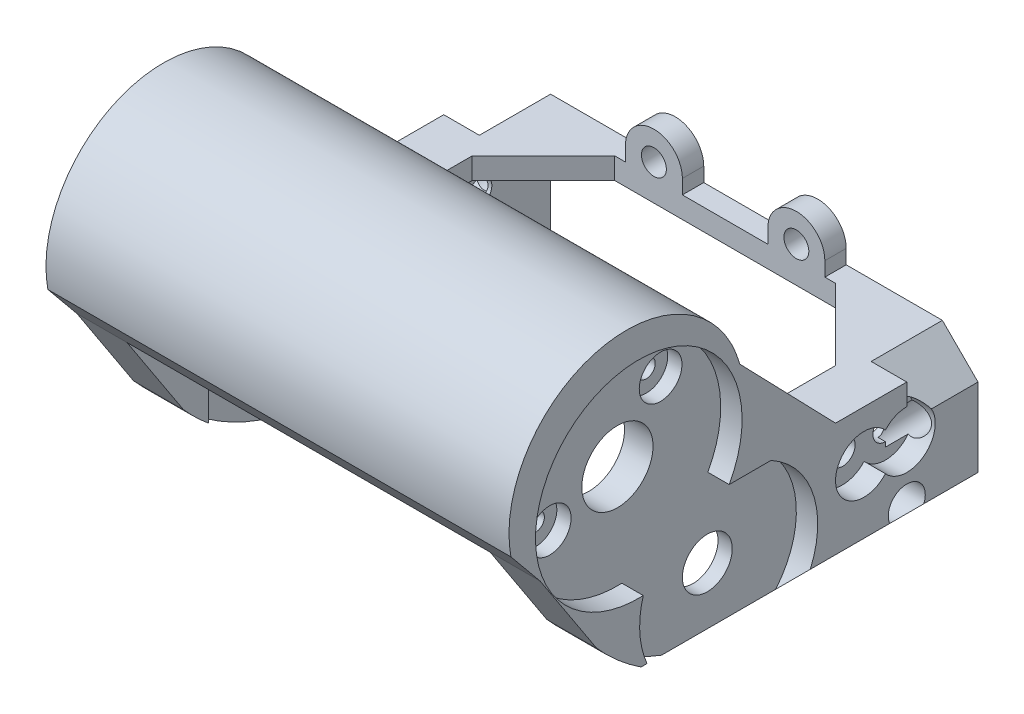
from build123d import *

# Parameters (mm, degrees)
BOSS_EXTRUDE1_DEPTH             = 50
CHAMFER1_SIZE                   = 7
SKETCH2_R                       = 3.5
CUT_EXTRUDE1_DEPTH              = 62.524385409
SKETCH3_R                       = 1.75
CUT_EXTRUDE2_DEPTH              = 62.524385409
SKETCH5_R                       = 12.5
CUT_EXTRUDE4_DEPTH              = 3
BOSS_EXTRUDE2_DEPTH             = 7
CUT_EXTRUDE3_DEPTH              = 77.547867994
CUT_EXTRUDE3_DEPTH_BACK         = 77.547867994
SKETCH4_W                       = 51
SKETCH4_H                       = 47
SKETCH7_R                       = 1.25
SKETCH7_R_2                     = 5
CUT_EXTRUDE5_DEPTH              = 103.505990745
SKETCH8_R                       = 14.5
CUT_EXTRUDE6_DEPTH              = 3
SKETCH9_R                       = 3
CUT_EXTRUDE7_DEPTH              = 2
SKETCH11_R                      = 2
CUT_EXTRUDE8_DEPTH              = 10
BOSS_EXTRUDE3_START             = -32.5
BOSS_EXTRUDE3_DEPTH             = 65
SKETCH12_R                      = 2.6
CUT_EXTRUDE9_DEPTH              = 105.684053225
CUT_EXTRUDE10_DEPTH             = 3
BOSS_EXTRUDE4_DEPTH             = 3
SKETCH16_R                      = 1.75
CUT_EXTRUDE12_DEPTH             = 8
CHAMFER2_SIZE                   = 10
CUT_EXTRUDE14_DEPTH             = 10
CUT_EXTRUDE15_DEPTH             = 89.260982281
CUT_EXTRUDE15_DEPTH_BACK        = 89.260982281
CUT_EXTRUDE16_REACH             = 90.261
SKETCH19_R                      = 11
CUT_EXTRUDE16_DIRECTION_2_REACH = 90.261


# Read off the part's stored shape, not the designer's step: Mirror1
with BuildPart() as part:
    # Sketch1 → Boss-Extrude1 (new body)
    with BuildSketch(Plane.XY):
        Polygon((-27.5, 0), (-27.5, 20), (0, 20), (0, 23), (-32.5, 23), (-32.5, 0), align=None)
    extrude(amount=BOSS_EXTRUDE1_DEPTH)

    # Chamfer1
    # the kernel refuses this chamfer: 7 mm, written as the material it takes off along each edge
    with BuildSketch(Plane(origin=(-32.5, 0, -18.001780916), x_dir=(-0.02749587661058612, 0.9996219169112968, 0), z_dir=(0, 0, 1))) as chamfer1_piece_1:
        Polygon((CHAMFER1_SIZE * 0.999621916911, -CHAMFER1_SIZE * 0.0274958766106), (-CHAMFER1_SIZE * 0.0274958766106, -CHAMFER1_SIZE * 0.999621916911), (0, 0), align=None)
    extrude(amount=86.003561832, mode=Mode.SUBTRACT)

    # Sketch2 → Cut-Extrude1 (cut, through all)
    with BuildSketch(Plane(origin=(-27.5, 0, 0), x_dir=(0, 0, -1), z_dir=(1, 0, 0))):
        with Locations((-35, 12)):
            Circle(SKETCH2_R)
    extrude(amount=-CUT_EXTRUDE1_DEPTH, mode=Mode.SUBTRACT)

    # Sketch3 → Cut-Extrude2 (cut, through all)
    with BuildSketch(Plane(origin=(-27.5, 0, 0), x_dir=(0, 0, -1), z_dir=(1, 0, 0))):
        with Locations((-10, 16)):
            Circle(SKETCH3_R)
        with Locations((-16, 16)):
            Circle(SKETCH3_R)
    extrude(amount=-CUT_EXTRUDE2_DEPTH, mode=Mode.SUBTRACT)

    # Sketch5 → Cut-Extrude4 (cut)
    with BuildSketch(Plane.ZY.offset(32.5)):
        with Locations((35, 12)):
            Circle(SKETCH5_R)
    extrude(amount=-CUT_EXTRUDE4_DEPTH, mode=Mode.SUBTRACT)

    # Sketch6 → Boss-Extrude2 (add)
    with BuildSketch(Plane.ZY.offset(32.5)):
        with BuildLine():
            Line((38.91656851, 42.559195759), (20, 23))
            Line((20, 23), (41.190648452, 23))
            ThreePointArc((41.190648452, 23), (45.305332833, 20.647646722), (50, 19.996268429))
            Line((50, 19.996268429), (50, 7))
            Line((50, 7), (61.474012963, 24.541456905))
            ThreePointArc((61.474012963, 24.541456905), (58.38884507, 43.808308659), (38.91656851, 42.559195759))
        make_face()
    extrude(amount=-BOSS_EXTRUDE2_DEPTH)

    # Mirror1: part across plane


with BuildPart() as part_1:
    add(part.part)
    add(part.part.mirror(Plane(origin=(0, 0, 0), x_dir=(0, 0, 1), z_dir=(1, 0, 0))))

    # Sketch4 → Cut-Extrude3 (cut, two sides: drawn at the far end of the back side and taken through both)
    with BuildSketch(Plane.XZ.offset(-20).offset(-CUT_EXTRUDE3_DEPTH_BACK)):
        with Locations((0, 26.5)):
            Rectangle(SKETCH4_W, SKETCH4_H)
    extrude(amount=CUT_EXTRUDE3_DEPTH + CUT_EXTRUDE3_DEPTH_BACK, mode=Mode.SUBTRACT)

    # Sketch7 → Cut-Extrude5 (cut, through all)
    with BuildSketch(Plane.ZY.offset(32.5)):
        with Locations(Location((41.557466488, 37.927777253, 0), (0, 0, 270))):
            Circle(SKETCH7_R)
        with Locations(Location((57.12135533, 27.029824962, 0), (0, 0, 270))):
            Circle(SKETCH7_R)
        with Locations(Location((47.6186816, 30.021344974, 0), (0, 0, 270))):
            Circle(SKETCH7_R_2)
    extrude(amount=-CUT_EXTRUDE5_DEPTH, mode=Mode.SUBTRACT)

    # Sketch8 → Cut-Extrude6 (cut)
    with BuildSketch(Plane.ZY.offset(32.5)):
        with Locations((47.6186816, 30.021344974)):
            Circle(SKETCH8_R)
    cut_extrude6 = extrude(amount=-CUT_EXTRUDE6_DEPTH, mode=Mode.SUBTRACT)

    # Sketch9 → Cut-Extrude7 (cut)
    with BuildSketch(Plane.ZY.offset(29.5)):
        with Locations(Location((41.557466488, 37.927777253, 0), (0, 0, 270))):
            Circle(SKETCH9_R)
        with Locations(Location((57.12135533, 27.029824962, 0), (0, 0, 270))):
            Circle(SKETCH9_R)
    cut_extrude7 = extrude(amount=-CUT_EXTRUDE7_DEPTH, mode=Mode.SUBTRACT)

    # Sketch11 → Cut-Extrude8 (cut)
    with BuildSketch(Plane(origin=(0, 0, 0), x_dir=(-1, 0, 0), z_dir=(0, 0, -1))):
        with Locations((-30, 15.523029521)):
            Circle(SKETCH11_R)
    cut_extrude8 = extrude(amount=-CUT_EXTRUDE8_DEPTH, mode=Mode.SUBTRACT)

    # Mirror2: Cut-Extrude6, Cut-Extrude7, Cut-Extrude8 across plane
    add(cut_extrude6.mirror(Plane(origin=(0, 0, 0), x_dir=(0, 0, 1), z_dir=(1, 0, 0))), mode=Mode.SUBTRACT)
    add(cut_extrude7.mirror(Plane(origin=(0, 0, 0), x_dir=(0, 0, 1), z_dir=(1, 0, 0))), mode=Mode.SUBTRACT)
    add(cut_extrude8.mirror(Plane(origin=(0, 0, 0), x_dir=(0, 0, 1), z_dir=(1, 0, 0))), mode=Mode.SUBTRACT)

    # Sketch10 → Boss-Extrude3 (add)
    with BuildSketch(Plane(origin=(0, 0, 0), x_dir=(0, 0, -1), z_dir=(1, 0, 0)).offset(BOSS_EXTRUDE3_START)):
        with BuildLine():
            Line((-38.91656851, 42.559195759), (-33.44256114, 36.899227268))
            ThreePointArc((-33.44256114, 36.899227268), (-53.026270805, 48.561620018), (-65.574367209, 29.533263138))
            Line((-65.574367209, 29.533263138), (-61.474012963, 24.541456905))
            ThreePointArc((-61.474012963, 24.541456905), (-58.38884507, 43.808308659), (-38.91656851, 42.559195759))
        make_face()
    extrude(amount=BOSS_EXTRUDE3_DEPTH)

    # Sketch12 → Cut-Extrude9 (cut, through all)
    with BuildSketch(Plane(origin=(32.5, 0, 0), x_dir=(0, 0, -1), z_dir=(1, 0, 0))):
        with Locations(Location((-10, 8, 0), (0, 0, 180))):
            Circle(SKETCH12_R)
    extrude(amount=-CUT_EXTRUDE9_DEPTH, mode=Mode.SUBTRACT)

    # Sketch13 → Cut-Extrude10 (cut)
    with BuildSketch(Plane(origin=(32.5, 0, 0), x_dir=(0, 0, -1), z_dir=(1, 0, 0))):
        with BuildLine():
            ThreePointArc((-13, 18.645751311), (-20, 16), (-13, 13.354248689))
            ThreePointArc((-13, 13.354248689), (-6, 16), (-13, 18.645751311))
        make_face()
    cut_extrude10 = extrude(amount=-CUT_EXTRUDE10_DEPTH, mode=Mode.SUBTRACT)

    # Mirror3: Cut-Extrude10 across plane
    add(cut_extrude10.mirror(Plane(origin=(0, 0, 0), x_dir=(0, 0, 1), z_dir=(1, 0, 0))), mode=Mode.SUBTRACT)

    # Sketch15 → Boss-Extrude4 (add)
    with BuildSketch(Plane(origin=(0, 0, 0), x_dir=(-1, 0, 0), z_dir=(0, 0, -1))):
        with BuildLine():
            Line((-14, 25), (-14, 23))
            Line((-14, 23), (-6, 23))
            Line((-6, 23), (-6, 25))
            ThreePointArc((-6, 25), (-10, 29), (-14, 25))
        make_face()
        with BuildLine():
            Line((6, 23), (6, 25))
            ThreePointArc((6, 25), (10, 29), (14, 25))
            Line((14, 25), (14, 23))
            Line((14, 23), (6, 23))
        make_face()
    extrude(amount=-BOSS_EXTRUDE4_DEPTH)

    # Sketch16 → Cut-Extrude12 (cut)
    with BuildSketch(Plane(origin=(0, 0, 0), x_dir=(-1, 0, 0), z_dir=(0, 0, -1))):
        with Locations((-10, 25)):
            Circle(SKETCH16_R)
        with Locations((10, 25)):
            Circle(SKETCH16_R)
    extrude(amount=-CUT_EXTRUDE12_DEPTH, mode=Mode.SUBTRACT)

    # Chamfer2
    chamfer2_edges = [part_1.edges().sort_by_distance(p)[0] for p in [
        (25.5, 21.5, 3),
        (-25.5, 21.5, 3),
    ]]
    chamfer(chamfer2_edges, length=CHAMFER2_SIZE)

    # Sketch17 → Cut-Extrude14 (cut)
    with BuildSketch(Plane(origin=(0, 0, 0), x_dir=(-1, 0, 0), z_dir=(0, 0, -1))):
        Polygon((-32.5, 18), (-32.5, 23), (-27.5, 23), align=None)
        Polygon((32.5, 23), (27.5, 23), (32.5, 18), align=None)
    extrude(amount=-CUT_EXTRUDE14_DEPTH, mode=Mode.SUBTRACT)

    # Sketch18 → Cut-Extrude15 (cut, two sides: drawn at the far end of the back side and taken through both)
    with BuildSketch(Plane(origin=(0, 0, 0), x_dir=(0, 0, -1), z_dir=(1, 0, 0)).offset(-CUT_EXTRUDE15_DEPTH_BACK)):
        with BuildLine():
            Line((-30.530550933, 2), (-50, 2))
            Line((-50, 2), (-58.261274719, 19.629826629))
            ThreePointArc((-58.261274719, 19.629826629), (-46.960735265, 6.780592155), (-30.530550933, 2))
        make_face()
    extrude(amount=CUT_EXTRUDE15_DEPTH + CUT_EXTRUDE15_DEPTH_BACK, mode=Mode.SUBTRACT)

    # Cut-Extrude16: up to this face of the body (flat: up to its plane)
    cut_extrude16_end = Plane(part_1.part.faces().sort_by_distance((-27.5, 11.293188811, 24.090581316))[0])
    # Sketch19 → Cut-Extrude16 (cut, up to the picked face)
    with BuildSketch(Plane(origin=(0, 0, 0), x_dir=(0, 0, -1), z_dir=(1, 0, 0)), mode=Mode.PRIVATE) as cut_extrude16_sk1:
        with Locations((-35, 12)):
            Circle(SKETCH19_R)
    cut_extrude16_tool1 = split(extrude(cut_extrude16_sk1.sketch, amount=-CUT_EXTRUDE16_REACH, mode=Mode.PRIVATE), bisect_by=cut_extrude16_end, keep=Keep.BOTH, mode=Mode.PRIVATE)
    add(cut_extrude16_tool1.solids().sort_by(Axis((0, 12, 35), (-1, 0, 0)))[0], mode=Mode.SUBTRACT)

    # Cut-Extrude16 direction 2: up to this face of the body (flat: up to its plane)
    cut_extrude16_direction_2_end = Plane(part_1.part.faces().sort_by_distance((27.5, 11.293188811, 24.090581316))[0])
    # Sketch19 → Cut-Extrude16 direction 2 (cut, up to the picked face)
    with BuildSketch(Plane(origin=(0, 0, 0), x_dir=(0, 0, -1), z_dir=(1, 0, 0)), mode=Mode.PRIVATE) as cut_extrude16_direction_2_sk1:
        with Locations((-35, 12)):
            Circle(SKETCH19_R)
    cut_extrude16_direction_2_tool1 = split(extrude(cut_extrude16_direction_2_sk1.sketch, amount=CUT_EXTRUDE16_DIRECTION_2_REACH, mode=Mode.PRIVATE), bisect_by=cut_extrude16_direction_2_end, keep=Keep.BOTH, mode=Mode.PRIVATE)
    add(cut_extrude16_direction_2_tool1.solids().sort_by(Axis((0, 12, 35), (1, 0, 0)))[0], mode=Mode.SUBTRACT)


solid = part_1.part
